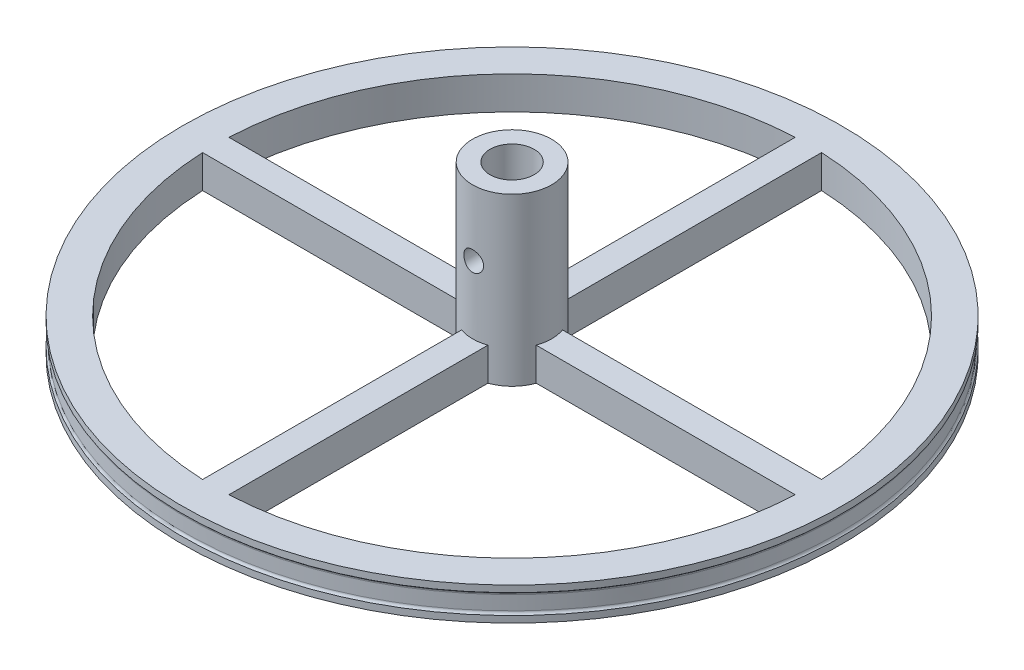
from build123d import *

# Parameters (mm, degrees)
REVOLVE1_ANGLE                 = 90
BOSS_EXTRUDE2_DEPTH            = 22.5
CUT_EXTRUDE1_DEPTH             = 74.549310272
MIRROR3_START                  = -2.736132077
MIRROR3_DEPTH                  = 5
MIRROR3_START_2                = 2.263867923
MIRROR3_2_DEPTH                = 20.236132077
MIRROR3_3_DEPTH                = 1
MIRROR3_START_3                = 1.263867923
MIRROR3_4_DEPTH                = 1
MIRROR4_START                  = -2.736132077
MIRROR4_DEPTH                  = 5
MIRROR4_START_2                = 2.263867923
MIRROR4_2_DEPTH                = 20.236132077
MIRROR4_3_DEPTH                = 1
MIRROR4_START_3                = 1.263867923
MIRROR4_4_DEPTH                = 1
SKETCH7_R                      = 3.35
CUT_EXTRUDE2_DEPTH             = 20
FILLET9_R                      = 0.5
CUT_EXTRUDE3_REACH             = 76.204
SKETCH8_R                      = 1.5
CUT_EXTRUDE3_DIRECTION_2_REACH = 76.204


# Read off the part's stored shape, not the designer's step: Mirror3, Mirror4
with BuildPart() as part:
    # Sketch1 → Revolve1 (revolve)
    with BuildSketch(Plane.XY):
        Polygon((0, 2.263867923), (0, -2.736132077), (50, -2.736132077), (50, -1.736132077), (49.75, -1.736132077), (49.75, 1.263867923), (50, 1.263867923), (50, 2.263867923), align=None)
    revolve(axis=Axis((0, 2.263867923, 0), (0, -1, 0)), revolution_arc=REVOLVE1_ANGLE)

    # Sketch2 → Boss-Extrude2 (add)
    with BuildSketch(Plane(origin=(0, 0, 0), x_dir=(1, 0, 0), z_dir=(0, 1, 0))):
        with BuildLine():
            Line((0, 0), (6, 0))
            ThreePointArc((6, 0), (4.242640687, -4.242640687), (0, -6))
            Line((0, -6), (0, 0))
        make_face()
    extrude(amount=BOSS_EXTRUDE2_DEPTH)

    # Sketch6 → Cut-Extrude1 (cut, through all)
    with BuildSketch(Plane(origin=(0, 2.263867923, 0), x_dir=(1, 0, 0), z_dir=(0, 1, 0))):
        with BuildLine():
            Line((2, -5.656854249), (2, -44.955533586))
            ThreePointArc((2, -44.955533586), (31.819805153, -31.819805153), (44.955533586, -2))
            Line((44.955533586, -2), (5.656854249, -2))
            ThreePointArc((5.656854249, -2), (4.242640687, -4.242640687), (2, -5.656854249))
        make_face()
    extrude(amount=-CUT_EXTRUDE1_DEPTH, mode=Mode.SUBTRACT)

    # Mirror3 outline → Mirror3 (add)
    with BuildSketch(Plane(origin=(0, 0, 0), x_dir=(1, 0, 0), z_dir=(0, 1, 0)).offset(MIRROR3_START)):
        with BuildLine():
            ThreePointArc((49.75, 0), (35.178562364, 35.178562364), (0, 49.75))
            Line((0, 49.75), (0, 0))
            Line((0, 0), (49.75, 0))
        make_face()
        with BuildLine():
            Line((44.955533586, 2), (5.656854249, 2))
            ThreePointArc((5.656854249, 2), (4.242640687, 4.242640687), (2, 5.656854249))
            Line((2, 5.656854249), (2, 44.955533586))
            ThreePointArc((2, 44.955533586), (31.819805153, 31.819805153), (44.955533586, 2))
        make_face(mode=Mode.SUBTRACT)
    extrude(amount=MIRROR3_DEPTH)

    # Mirror3 2 outline → Mirror3 2 (add)
    with BuildSketch(Plane(origin=(0, 0, 0), x_dir=(1, 0, 0), z_dir=(0, 1, 0)).offset(MIRROR3_START_2)):
        with BuildLine():
            Line((0, 0), (6, 0))
            ThreePointArc((6, 0), (4.242640687, 4.242640687), (0, 6))
            Line((0, 6), (0, 0))
        make_face()
    extrude(amount=MIRROR3_2_DEPTH)

    # Mirror3 3 outline → Mirror3 3 (add)
    with BuildSketch(Plane(origin=(0, 0, 0), x_dir=(1, 0, 0), z_dir=(0, 1, 0)).offset(MIRROR3_START)):
        with BuildLine():
            Line((49.75, 0), (50, 0))
            ThreePointArc((50, 0), (35.355339059, 35.355339059), (0, 50))
            Line((0, 50), (0, 49.75))
            ThreePointArc((0, 49.75), (35.178562364, 35.178562364), (49.75, 0))
        make_face()
    extrude(amount=MIRROR3_3_DEPTH)

    # Mirror3 4 outline → Mirror3 4 (add)
    with BuildSketch(Plane(origin=(0, 0, 0), x_dir=(1, 0, 0), z_dir=(0, 1, 0)).offset(MIRROR3_START_3)):
        with BuildLine():
            Line((49.75, 0), (50, 0))
            ThreePointArc((50, 0), (35.355339059, 35.355339059), (0, 50))
            Line((0, 50), (0, 49.75))
            ThreePointArc((0, 49.75), (35.178562364, 35.178562364), (49.75, 0))
        make_face()
    extrude(amount=MIRROR3_4_DEPTH)

    # Mirror4 outline → Mirror4 (add)
    with BuildSketch(Plane(origin=(0, 0, 0), x_dir=(1, 0, 0), z_dir=(0, 1, 0)).offset(MIRROR4_START)):
        with BuildLine():
            ThreePointArc((0, 49.75), (-49.75, 0), (0, -49.75))
            Line((0, -49.75), (0, 49.75))
        make_face()
        with BuildLine():
            Line((-2, 44.955533586), (-2, 5.656854249))
            ThreePointArc((-2, 5.656854249), (-4.242640687, 4.242640687), (-5.656854249, 2))
            Line((-5.656854249, 2), (-44.955533586, 2))
            ThreePointArc((-44.955533586, 2), (-31.819805153, 31.819805153), (-2, 44.955533586))
        make_face(mode=Mode.SUBTRACT)
        with BuildLine():
            Line((-44.955533586, -2), (-5.656854249, -2))
            ThreePointArc((-5.656854249, -2), (-4.242640687, -4.242640687), (-2, -5.656854249))
            Line((-2, -5.656854249), (-2, -44.955533586))
            ThreePointArc((-2, -44.955533586), (-31.819805153, -31.819805153), (-44.955533586, -2))
        make_face(mode=Mode.SUBTRACT)
    extrude(amount=MIRROR4_DEPTH)

    # Mirror4 2 outline → Mirror4 2 (add)
    with BuildSketch(Plane(origin=(0, 0, 0), x_dir=(1, 0, 0), z_dir=(0, 1, 0)).offset(MIRROR4_START_2)):
        with BuildLine():
            Line((0, -6), (0, 6))
            ThreePointArc((0, 6), (-6, 0), (0, -6))
        make_face()
    extrude(amount=MIRROR4_2_DEPTH)

    # Mirror4 3 outline → Mirror4 3 (add)
    with BuildSketch(Plane(origin=(0, 0, 0), x_dir=(1, 0, 0), z_dir=(0, 1, 0)).offset(MIRROR4_START)):
        with BuildLine():
            Line((0, 49.75), (0, 50))
            ThreePointArc((0, 50), (-50, 0), (0, -50))
            Line((0, -50), (0, -49.75))
            ThreePointArc((0, -49.75), (-49.75, 0), (0, 49.75))
        make_face()
    extrude(amount=MIRROR4_3_DEPTH)

    # Mirror4 4 outline → Mirror4 4 (add)
    with BuildSketch(Plane(origin=(0, 0, 0), x_dir=(1, 0, 0), z_dir=(0, 1, 0)).offset(MIRROR4_START_3)):
        with BuildLine():
            Line((0, 49.75), (0, 50))
            ThreePointArc((0, 50), (-50, 0), (0, -50))
            Line((0, -50), (0, -49.75))
            ThreePointArc((0, -49.75), (-49.75, 0), (0, 49.75))
        make_face()
    extrude(amount=MIRROR4_4_DEPTH)

    # Sketch7 → Cut-Extrude2 (cut)
    with BuildSketch(Plane(origin=(0, 22.5, 0), x_dir=(1, 0, 0), z_dir=(0, 1, 0))):
        with Locations(Location((0, 0, 0), (0, 0, 270))):
            Circle(SKETCH7_R)
    extrude(amount=-CUT_EXTRUDE2_DEPTH, mode=Mode.SUBTRACT)

    # Fillet9
    # the kernel refuses this fillet: 0.5 mm, written as the material it adds along each edge
    with BuildSketch(Plane(origin=(0, 1.263867923, 0), x_dir=(0, 0, 1), z_dir=(1, 0, 0))) as fillet9_piece_1:
        with BuildLine():
            CenterArc((50.25, 0.433012702), FILLET9_R, 180, 60)
            Line((50, 0), (49.995, -0.008660254))
            ThreePointArc((49.995, -0.008660254), (49.875, -0.01), (49.75, -0.01))
            Line((49.75, -0.01), (49.74, 0))
            Line((49.74, 0), (49.74, 0.433012702))
            Line((49.74, 0.433012702), (49.75, 0.433012702))
        make_face()
    revolve(axis=Axis((0, 1.263867923, 0), (0, -1, 0)), revolution_arc=180)
    with BuildSketch(Plane(origin=(0, -1.736132077, 0), x_dir=(0, 0, 1), z_dir=(1, 0, 0))) as fillet9_piece_2:
        with BuildLine():
            CenterArc((50.25, -0.433012702), FILLET9_R, 120, 60)
            Line((49.75, -0.433012702), (49.74, -0.433012702))
            Line((49.74, -0.433012702), (49.74, 0))
            Line((49.74, 0), (49.75, 0.01))
            ThreePointArc((49.75, 0.01), (49.875, 0.01), (49.995, 0.008660254))
            Line((49.995, 0.008660254), (50, 0))
        make_face()
    revolve(axis=Axis((0, -1.736132077, 0), (0, -1, 0)), revolution_arc=180)
    with BuildSketch(Plane(origin=(0, -1.736132077, 0), x_dir=(1, 0, 0), z_dir=(0, 0, -1))) as fillet9_piece_3:
        with BuildLine():
            CenterArc((50.25, -0.433012702), FILLET9_R, 120, 60)
            Line((49.75, -0.433012702), (49.74, -0.433012702))
            Line((49.74, -0.433012702), (49.74, 0))
            Line((49.74, 0), (49.75, 0.01))
            ThreePointArc((49.75, 0.01), (49.875, 0.01), (49.995, 0.008660254))
            Line((49.995, 0.008660254), (50, 0))
        make_face()
    revolve(axis=Axis((0, -1.736132077, 0), (0, -1, 0)), revolution_arc=90)
    with BuildSketch(Plane(origin=(0, -1.736132077, 0), x_dir=(2.109490694905436e-12, 0, -1.0), z_dir=(-1.0, 0, -2.109490694905436e-12))) as fillet9_piece_4:
        with BuildLine():
            CenterArc((50.25, -0.433012702), FILLET9_R, 120, 60)
            Line((49.75, -0.433012702), (49.74, -0.433012702))
            Line((49.74, -0.433012702), (49.74, 0))
            Line((49.74, 0), (49.75, 0.01))
            ThreePointArc((49.75, 0.01), (49.875, 0.01), (49.995, 0.008660254))
            Line((49.995, 0.008660254), (50, 0))
        make_face()
    revolve(axis=Axis((0, -1.736132077, 0), (0, -1, 0)), revolution_arc=90)
    with BuildSketch(Plane(origin=(0, 1.263867923, 0), x_dir=(1, 0, 0), z_dir=(0, 0, -1))) as fillet9_piece_5:
        with BuildLine():
            CenterArc((50.25, 0.433012702), FILLET9_R, 180, 60)
            Line((50, 0), (49.995, -0.008660254))
            ThreePointArc((49.995, -0.008660254), (49.875, -0.01), (49.75, -0.01))
            Line((49.75, -0.01), (49.74, 0))
            Line((49.74, 0), (49.74, 0.433012702))
            Line((49.74, 0.433012702), (49.75, 0.433012702))
        make_face()
    revolve(axis=Axis((0, 1.263867923, 0), (0, -1, 0)), revolution_arc=90)
    with BuildSketch(Plane(origin=(0, 1.263867923, 0), x_dir=(2.109490694905436e-12, 0, -1.0), z_dir=(-1.0, 0, -2.109490694905436e-12))) as fillet9_piece_6:
        with BuildLine():
            CenterArc((50.25, 0.433012702), FILLET9_R, 180, 60)
            Line((50, 0), (49.995, -0.008660254))
            ThreePointArc((49.995, -0.008660254), (49.875, -0.01), (49.75, -0.01))
            Line((49.75, -0.01), (49.74, 0))
            Line((49.74, 0), (49.74, 0.433012702))
            Line((49.74, 0.433012702), (49.75, 0.433012702))
        make_face()
    revolve(axis=Axis((0, 1.263867923, 0), (0, -1, 0)), revolution_arc=90)

    # Sketch8 → Cut-Extrude3 (cut, up to next)
    with BuildSketch(Plane.XY, mode=Mode.PRIVATE) as cut_extrude3_sk1:
        with Locations((0, 12.5)):
            Circle(SKETCH8_R)
    cut_extrude3_tool1 = extrude(cut_extrude3_sk1.sketch, amount=-CUT_EXTRUDE3_REACH, mode=Mode.PRIVATE) & part.part
    add(cut_extrude3_tool1.solids().sort_by_distance((0, 12.5, 0))[0], mode=Mode.SUBTRACT)

    # Sketch8 → Cut-Extrude3 direction 2 (cut, up to next)
    with BuildSketch(Plane.XY, mode=Mode.PRIVATE) as cut_extrude3_direction_2_sk1:
        with Locations((0, 12.5)):
            Circle(SKETCH8_R)
    cut_extrude3_direction_2_tool1 = extrude(cut_extrude3_direction_2_sk1.sketch, amount=CUT_EXTRUDE3_DIRECTION_2_REACH, mode=Mode.PRIVATE) & part.part
    add(cut_extrude3_direction_2_tool1.solids().sort_by_distance((0, 12.5, 0))[0], mode=Mode.SUBTRACT)


solid = part.part
